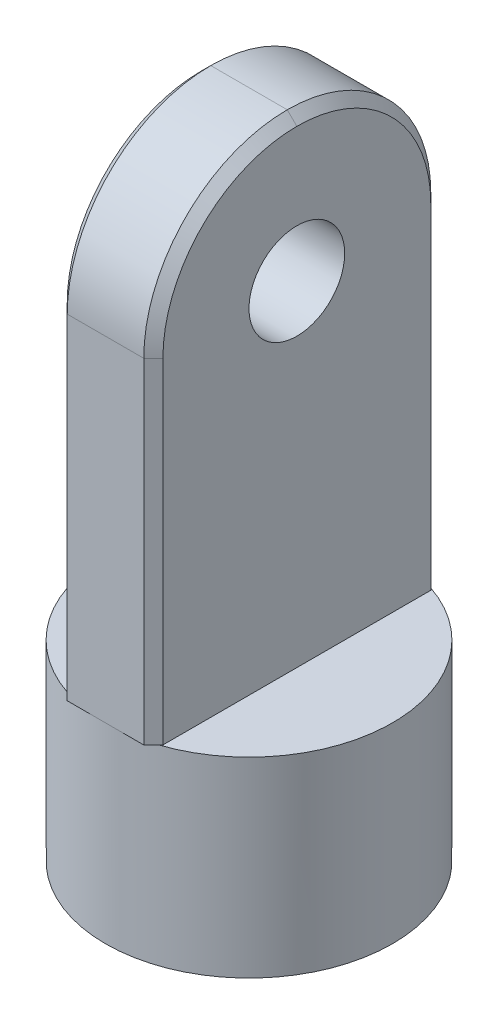
from build123d import *

# Parameters (mm, degrees)
SKETCH1_R           = 7.5
BOSS_EXTRUDE1_DEPTH = 10
SKETCH2_R           = 6.25
CUT_EXTRUDE2_DEPTH  = 7.5
SKETCH3_W           = 5
SKETCH3_H           = 15
BOSS_EXTRUDE2_DEPTH = 25
SKETCH4_R           = 2.5
CUT_EXTRUDE3_DEPTH  = 5
FILLET1_R           = 7.5
CHAMFER1_SIZE       = 0.5


# Some blends are built 0.0001 mm under size
with BuildPart() as part:
    # Sketch1 → Boss-Extrude1 (new body)
    with BuildSketch(Plane(origin=(0, 0, 0), x_dir=(1, 0, 0), z_dir=(0, 1, 0))):
        with Locations(Location((0, 0, 0), (0, 0, 270))):
            Circle(SKETCH1_R)
    extrude(amount=BOSS_EXTRUDE1_DEPTH)

    # Sketch2 → Cut-Extrude2 (cut)
    with BuildSketch(Plane.XZ):
        with Locations(Location((0, 0, 0), (0, 0, 270))):
            Circle(SKETCH2_R)
    extrude(amount=-CUT_EXTRUDE2_DEPTH, mode=Mode.SUBTRACT)

    # Sketch3 → Boss-Extrude2 (add)
    with BuildSketch(Plane(origin=(0, 10, 0), x_dir=(1, 0, 0), z_dir=(0, 1, 0))):
        Rectangle(SKETCH3_W, SKETCH3_H)
    extrude(amount=BOSS_EXTRUDE2_DEPTH)

    # Sketch4 → Cut-Extrude3 (cut)
    with BuildSketch(Plane(origin=(2.5, 0, 0), x_dir=(0, 0, -1), z_dir=(1, 0, 0))):
        with Locations((0, 27.5)):
            Circle(SKETCH4_R)
    extrude(amount=-CUT_EXTRUDE3_DEPTH, mode=Mode.SUBTRACT)

    # Fillet1
    fillet1_edges = [part.edges().sort_by_distance(p)[0] for p in [
        (0, 35, -7.5),
        (0, 35, 7.5),
    ]]
    fillet(fillet1_edges, radius=FILLET1_R - 0.0001)  # a hair under: the kernel refuses the full size

    # Chamfer1
    # the kernel refuses this chamfer: 0.5 mm, written as the material it takes off along each edge
    with BuildSketch(Plane(origin=(-2.5, 10, 7.5), x_dir=(-0.027495876610586462, 0, -0.9996219169112968), z_dir=(0, 1, 0)), Plane(origin=(2.5, 10, 7.5), x_dir=(-0.9996219169112968, 0, 0.027495876610585623), z_dir=(0, 1, 0))) as chamfer1_piece_1:
        Polygon((CHAMFER1_SIZE * 0.999621916911, -CHAMFER1_SIZE * 0.0274958766106), (-CHAMFER1_SIZE * 0.0274958766106, -CHAMFER1_SIZE * 0.999621916911), (0, 0), align=None)
    extrude(amount=17.5001, mode=Mode.SUBTRACT)
    with BuildSketch(Plane(origin=(-2.5, 10, -7.5), x_dir=(-0.02749587661058651, 0, 0.9996219169112968), z_dir=(0, 1, 0)), Plane(origin=(2.5, 10, -7.5), x_dir=(-0.9996219169112968, 0, -0.027495876610585623), z_dir=(0, 1, 0))) as chamfer1_piece_2:
        Polygon((CHAMFER1_SIZE * 0.999621916911, CHAMFER1_SIZE * 0.0274958766106), (-CHAMFER1_SIZE * 0.0274958766106, CHAMFER1_SIZE * 0.999621916911), (0, 0), align=None)
    extrude(amount=17.5001, mode=Mode.SUBTRACT)
    with BuildSketch(Plane(origin=(-2.5, 27.5001, 0.0001), x_dir=(0, 0, 1), z_dir=(0, -1, 0))) as chamfer1_piece_3:
        Polygon((7.4999 - CHAMFER1_SIZE, 0), (7.4999, -CHAMFER1_SIZE), (7.4999, 0), align=None)
    revolve(axis=Axis((-2.5, 27.5001, 0.0001), (-1, 0, 0)), revolution_arc=90, mode=Mode.SUBTRACT)
    with BuildSketch(Plane(origin=(-2.5, 27.5001, -0.0001), x_dir=(0, 0, -1), z_dir=(0, -1, 0))) as chamfer1_piece_4:
        Polygon((7.4999 - CHAMFER1_SIZE, 0), (7.4999, CHAMFER1_SIZE), (7.4999, 0), align=None)
    revolve(axis=Axis((-2.5, 27.5001, -0.0001), (1, 0, 0)), revolution_arc=90, mode=Mode.SUBTRACT)
    with BuildSketch(Plane(origin=(2.5, 27.5001, 0.0001), x_dir=(0, 0, 1), z_dir=(0, -1, 0))) as chamfer1_piece_5:
        Polygon((7.4999, CHAMFER1_SIZE), (7.4999 - CHAMFER1_SIZE, 0), (7.4999, 0), align=None)
    revolve(axis=Axis((2.5, 27.5001, 0.0001), (-1, 0, 0)), revolution_arc=90, mode=Mode.SUBTRACT)
    with BuildSketch(Plane(origin=(2.5, 27.5001, -0.0001), x_dir=(0, 0, -1), z_dir=(0, -1, 0))) as chamfer1_piece_6:
        Polygon((7.4999, -CHAMFER1_SIZE), (7.4999 - CHAMFER1_SIZE, 0), (7.4999, 0), align=None)
    revolve(axis=Axis((2.5, 27.5001, -0.0001), (1, 0, 0)), revolution_arc=90, mode=Mode.SUBTRACT)
    with BuildSketch(Plane(origin=(2.5, 35, 0.0001), x_dir=(-0.999621916911297, 0.027495876610582174, 0), z_dir=(0, 0, -1))) as chamfer1_piece_7:
        Polygon((CHAMFER1_SIZE * 0.999621916911, -CHAMFER1_SIZE * 0.0274958766106), (-CHAMFER1_SIZE * 0.0274958766106, -CHAMFER1_SIZE * 0.999621916911), (0, 0), align=None)
    extrude(amount=0.0002, mode=Mode.SUBTRACT)
    with BuildSketch(Plane(origin=(-2.5, 35, -0.0001), x_dir=(-0.027495876610586605, -0.9996219169112968, 0), z_dir=(0, 0, 1))) as chamfer1_piece_8:
        Polygon((CHAMFER1_SIZE * 0.999621916911, CHAMFER1_SIZE * 0.0274958766106), (-CHAMFER1_SIZE * 0.0274958766106, CHAMFER1_SIZE * 0.999621916911), (0, 0), align=None)
    extrude(amount=0.0002, mode=Mode.SUBTRACT)


solid = part.part
